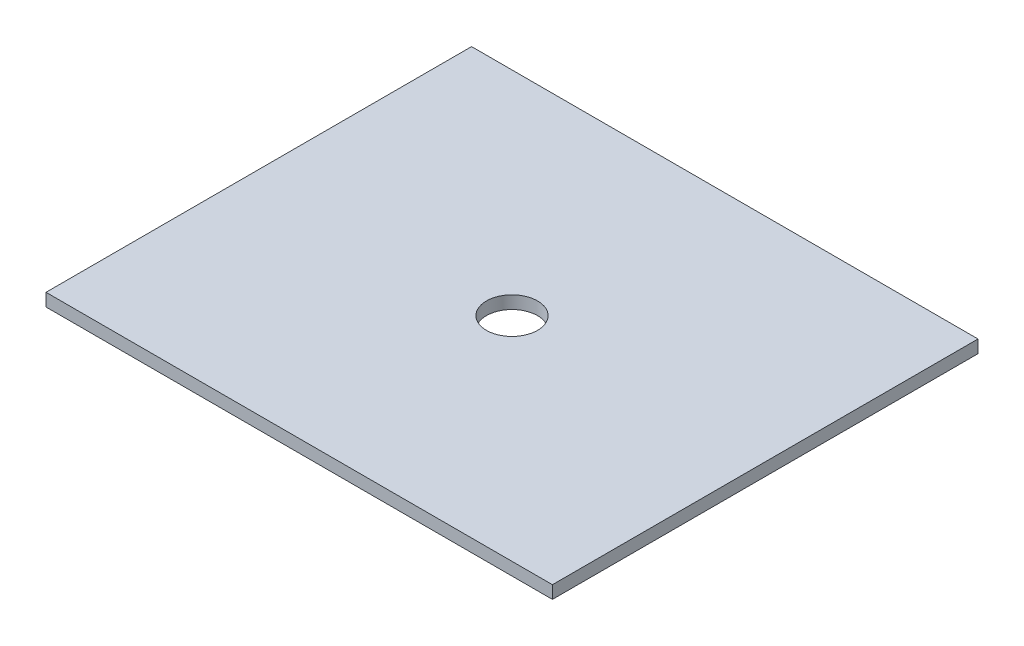
from build123d import *

# Parameters (mm, degrees)
SKETCH1_W           = 59.5
SKETCH1_H           = 50
SKETCH1_R           = 3
BOSS_EXTRUDE1_DEPTH = 1.5


with BuildPart() as part:
    # Sketch1 → Boss-Extrude1 (new body)
    with BuildSketch(Plane(origin=(0, 0, 0), x_dir=(1, 0, 0), z_dir=(0, 1, 0))):
        Rectangle(SKETCH1_W, SKETCH1_H)
        Circle(SKETCH1_R, mode=Mode.SUBTRACT)
    extrude(amount=BOSS_EXTRUDE1_DEPTH)


solid = part.part
